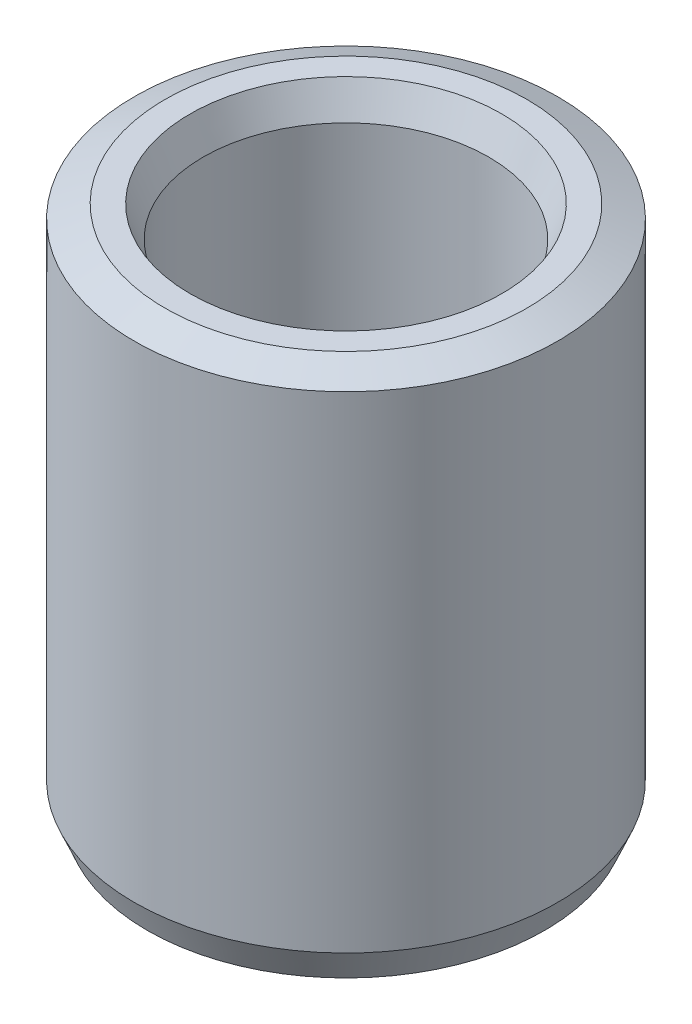
from build123d import *
from OCP.BRepFilletAPI import BRepFilletAPI_MakeChamfer

# Parameters (mm, degrees)
SKETCH1_R           = 55
BOSS_EXTRUDE1_DEPTH = 137.667811799
SKETCH2_R           = 37.077906611
CUT_EXTRUDE1_DEPTH  = 159.121555791
CHAMFER1_SIZE       = 3.394508267
CHAMFER1_SIZE2      = 8.01065186


with BuildPart() as part:
    # Sketch1 → Boss-Extrude1 (new body)
    with BuildSketch(Plane(origin=(0, 0, 0), x_dir=(1, 0, 0), z_dir=(0, 1, 0))):
        Circle(SKETCH1_R)
    extrude(amount=BOSS_EXTRUDE1_DEPTH)

    # Sketch2 → Cut-Extrude1 (cut, through all)
    with BuildSketch(Plane(origin=(0, 0, 0), x_dir=(1, 0, 0), z_dir=(0, 1, 0))):
        Circle(SKETCH2_R)
    extrude(amount=CUT_EXTRUDE1_DEPTH, mode=Mode.SUBTRACT)

    # Chamfer1: one chamfer whose edges measure the first distance from different faces: ONE call of the kernel's chamfer builder (chamfer() names one face for all edges)
    chamfer1_edges_1 = [part.edges().sort_by_distance(p)[0] for p in [
        (-37.077906611, 137.667811799, 0),
    ]]
    chamfer1_side_1 = [part.faces().sort_by_distance(p)[0] for p in [
        (-53.444365081, 137.667811799, 0),
    ]]
    chamfer1_edges_2 = [part.edges().sort_by_distance(p)[0] for p in [
        (-37.077906611, 0, 0),
    ]]
    chamfer1_side_2 = [part.faces().sort_by_distance(p)[0] for p in [
        (-37.077906611, 68.8339059, 0),
    ]]
    chamfer1_edges_3 = [part.edges().sort_by_distance(p)[0] for p in [
        (-55, 0, 0),
    ]]
    chamfer1_side_3 = [part.faces().sort_by_distance(p)[0] for p in [
        (-53.444365081, 0, 0),
    ]]
    chamfer1_edges_4 = [part.edges().sort_by_distance(p)[0] for p in [
        (-55, 137.667811799, 0),
    ]]
    chamfer1_side_4 = [part.faces().sort_by_distance(p)[0] for p in [
        (-55, 68.8339059, 0),
    ]]
    chamfer1 = BRepFilletAPI_MakeChamfer(part.part.solid().wrapped)
    for e in chamfer1_edges_1:
        chamfer1.Add(CHAMFER1_SIZE, CHAMFER1_SIZE2, e.wrapped, chamfer1_side_1[0].wrapped)  # the first distance lies on this face
    for e in chamfer1_edges_2:
        chamfer1.Add(CHAMFER1_SIZE, CHAMFER1_SIZE2, e.wrapped, chamfer1_side_2[0].wrapped)  # the first distance lies on this face
    for e in chamfer1_edges_3:
        chamfer1.Add(CHAMFER1_SIZE, CHAMFER1_SIZE2, e.wrapped, chamfer1_side_3[0].wrapped)  # the first distance lies on this face
    for e in chamfer1_edges_4:
        chamfer1.Add(CHAMFER1_SIZE, CHAMFER1_SIZE2, e.wrapped, chamfer1_side_4[0].wrapped)  # the first distance lies on this face
    add(Compound.cast(chamfer1.Shape()), mode=Mode.REPLACE)


solid = part.part
